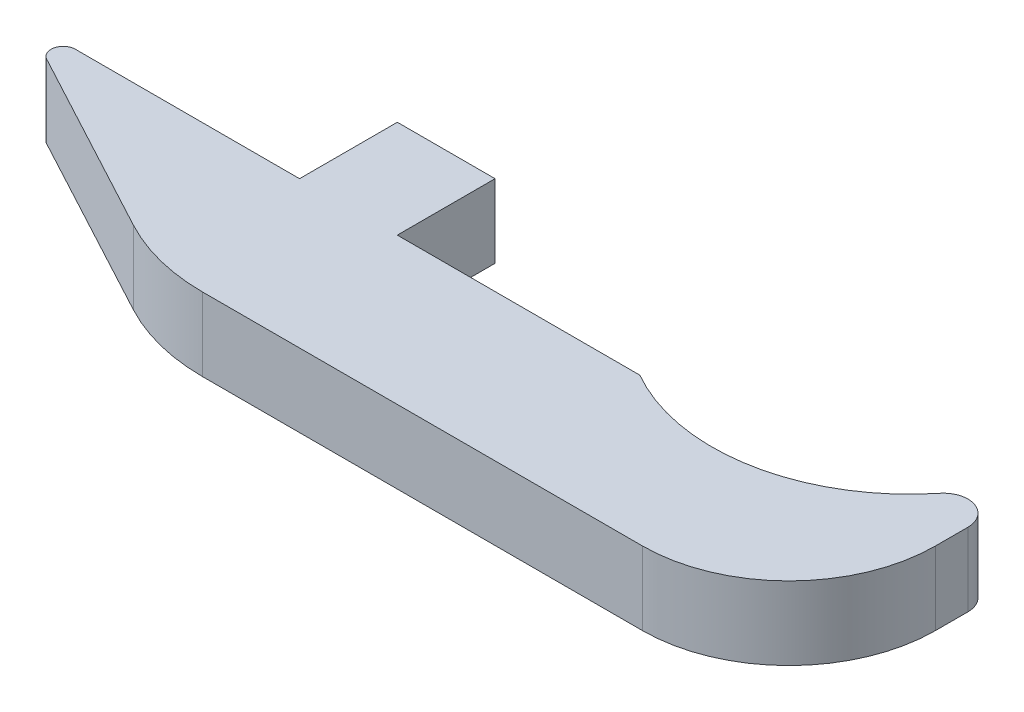
from build123d import *

# Parameters (mm, degrees)
BOSS_EXTRUDE1_DEPTH = 4.7625
FILLET1_R           = 9.525
FILLET2_R           = 1.5875
FILLET4_R           = 12.7
BOSS_EXTRUDE2_DEPTH = 4.7625
FILLET5_R           = 0.79375


with BuildPart() as part:
    # Sketch1 → Boss-Extrude1 (new body)
    with BuildSketch(Plane(origin=(0, 0, 0), x_dir=(1, 0, 0), z_dir=(0, 1, 0))):
        with BuildLine():
            ThreePointArc((62.20459999999994, 11.1252), (55.80558311010998, 0.02506657124609291), (42.993098926305386, 3.1797e-13))
            Line((42.993098926305315, 3.26e-15), (3.17499999999972, 1.85e-15))
            Line((3.174999999999723, -3.02e-15), (20.929599999999944, -9.525))
            Line((20.929599999999944, -9.525), (62.20459999999994, -9.525))
            Line((62.20459999999994, -9.525), (62.20459999999994, 11.125200000000005))
        make_face()
    extrude(amount=BOSS_EXTRUDE1_DEPTH)

    # Fillet1
    fillet1_edges = [part.edges().sort_by_distance(p)[0] for p in [
        (62.20459999999994, 2.38125, 9.525),
    ]]
    fillet(fillet1_edges, radius=FILLET1_R)

    # Fillet2
    fillet2_edges = [part.edges().sort_by_distance(p)[0] for p in [
        (62.20459999999994, 2.38125, -11.125200000000003),
    ]]
    fillet(fillet2_edges, radius=FILLET2_R)

    # Fillet4
    fillet4_edges = [part.edges().sort_by_distance(p)[0] for p in [
        (20.929599999999944, 2.38125, 9.525),
    ]]
    fillet(fillet4_edges, radius=FILLET4_R)

    # Sketch2 → Boss-Extrude2 (add)
    with BuildSketch(Plane.XZ):
        Polygon((20.889500000000094, -6.349999999999998), (27.239500000000092, -6.349999999999998), (27.239500000000096, 5.33e-15), (20.889500000000094, 4.43e-15), align=None)
    extrude(amount=-BOSS_EXTRUDE2_DEPTH)

    # Fillet5
    fillet5_edges = [part.edges().sort_by_distance(p)[0] for p in [
        (3.174999999999722, 2.38125, 5.9e-16),
    ]]
    fillet(fillet5_edges, radius=FILLET5_R)


solid = part.part
